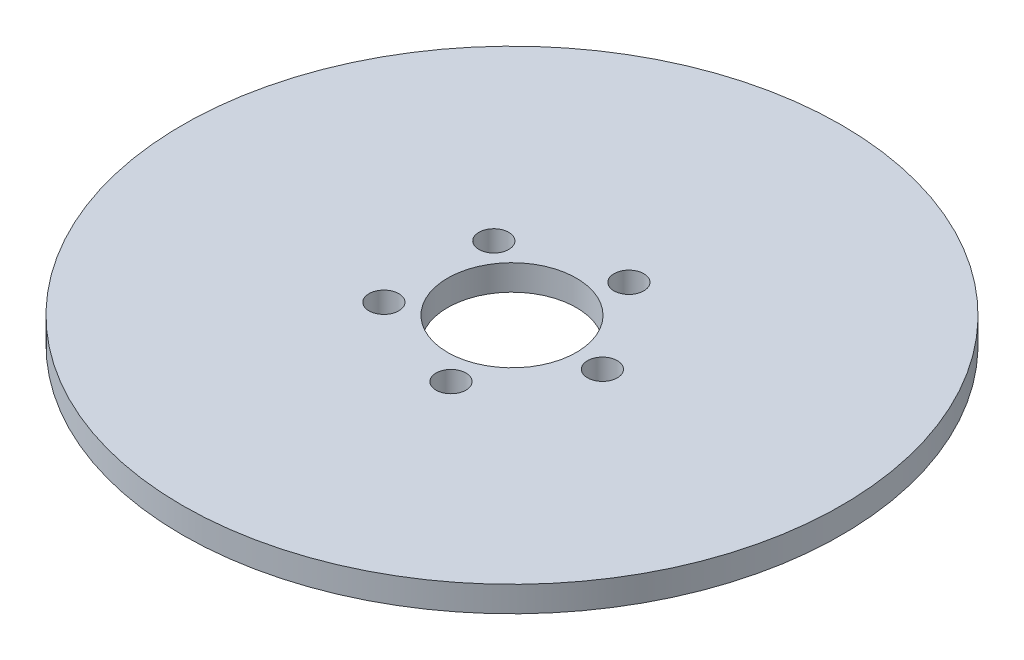
from build123d import *

# Parameters (mm, degrees)
SKETCH1_R           = 40.95
SKETCH1_R_2         = 8.001
SKETCH1_R_3         = 1.8542
BOSS_EXTRUDE1_DEPTH = 3.175


with BuildPart() as part:
    # Sketch1 → Boss-Extrude1 (new body)
    with BuildSketch(Plane(origin=(0, 1054.463973352, 0), x_dir=(-1, 0, 0), z_dir=(0, 1, 0))):
        with Locations((1.204093701, -633.11487505)):
            Circle(SKETCH1_R)
        with Locations((1.204093701, -633.11487505)):
            Circle(SKETCH1_R_2, mode=Mode.SUBTRACT)
        with Locations((10.336534073, -639.988260885)):
            Circle(SKETCH1_R_3, mode=Mode.SUBTRACT)
        with Locations((-2.510805411, -643.924335008)):
            Circle(SKETCH1_R_3, mode=Mode.SUBTRACT)
        with Locations((-10.224280588, -632.922102869)):
            Circle(SKETCH1_R_3, mode=Mode.SUBTRACT)
        with Locations((10.563151363, -626.553401155)):
            Circle(SKETCH1_R_3, mode=Mode.SUBTRACT)
        with Locations((-2.144130934, -622.186275332)):
            Circle(SKETCH1_R_3, mode=Mode.SUBTRACT)
    extrude(amount=-BOSS_EXTRUDE1_DEPTH)


solid = part.part
